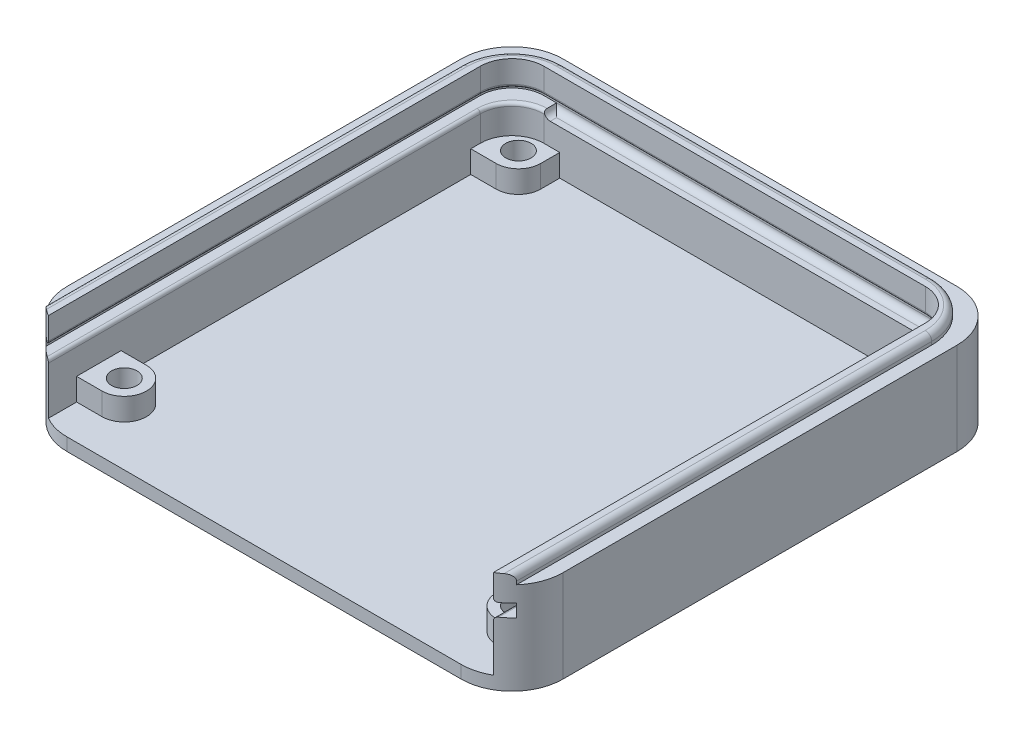
from build123d import *

# Parameters (mm, degrees)
BOSS_EXTRUDE1_DEPTH = 16
SKETCH2_4_W         = 74
SKETCH2_4_H         = 76
BOSS_EXTRUDE2_DEPTH = 2
SKETCH3_W           = 2
SKETCH3_H           = 4
SKETCH3_H_2         = 8
BOSS_EXTRUDE3_DEPTH = 76
LPATTERN1_COUNT     = 2
LPATTERN1_PITCH     = 72
SKETCH4_W           = 2
SKETCH4_H           = 4
SKETCH4_H_2         = 8
BOSS_EXTRUDE5_DEPTH = 71
FILLET2_R           = 5
SKETCH7_R           = 2
BOSS_EXTRUDE9_DEPTH = 3.5
SKETCH8_W           = 60
SKETCH8_H           = 1
CUT_EXTRUDE1_DEPTH  = 2
FILLET12_R          = 1
SKETCH11_W          = 2
SKETCH11_H          = 1.5
CUT_EXTRUDE2_DEPTH  = 112.462998345
SKETCH12_W          = 2
SKETCH12_H          = 1.5
CUT_EXTRUDE3_DEPTH  = 111.072703247
FILLET13_R          = 8
FILLET14_R          = 1
FILLET16_R          = 0.5


# Some blends are built 0.0001 mm under size
with BuildPart() as part:
    # Sketch2 → Boss-Extrude1 (new body)
    with BuildSketch(Plane(origin=(0, 0, 0), x_dir=(1, 0, 0), z_dir=(0, 1, 0))):
        Polygon((-78, 0), (-76, 0), (-76, 76), (-2, 76), (-2, 0), (0, 0), (0, 78), (-78, 78), align=None)
    extrude(amount=BOSS_EXTRUDE1_DEPTH)

    # Sketch2<4> → Boss-Extrude2 (add)
    with BuildSketch(Plane(origin=(0, 0, 0), x_dir=(1, 0, 0), z_dir=(0, 1, 0))):
        with Locations((-39, 38)):
            Rectangle(SKETCH2_4_W, SKETCH2_4_H)
    extrude(amount=BOSS_EXTRUDE2_DEPTH)

    # Sketch3 → Boss-Extrude3 (add)
    with BuildSketch(Plane.XY):
        with Locations((-75, 14)):
            Rectangle(SKETCH3_W, SKETCH3_H)
        with Locations((-75, 6)):
            Rectangle(SKETCH3_W, SKETCH3_H_2)
    boss_extrude3 = extrude(amount=-BOSS_EXTRUDE3_DEPTH)

    # LPattern1: Boss-Extrude3 ×2
    with Locations(*[(i * LPATTERN1_PITCH, 0, 0) for i in range(1, LPATTERN1_COUNT)]):
        add(boss_extrude3)

    # Sketch4 → Boss-Extrude5 (add)
    with BuildSketch(Plane(origin=(-74, 0, 0), x_dir=(0, 0, -1), z_dir=(1, 0, 0))):
        with Locations((75, 14)):
            Rectangle(SKETCH4_W, SKETCH4_H)
        with Locations((75, 6)):
            Rectangle(SKETCH4_W, SKETCH4_H_2)
    extrude(amount=BOSS_EXTRUDE5_DEPTH)

    # Fillet2
    fillet2_edges = [part.edges().sort_by_distance(p)[0] for p in [
        (-74, 14, -74),
        (-4, 6, -74),
        (-74, 6, -74),
        (-76, 11, -76),
        (-2, 11, -76),
        (-4, 14, -74),
    ]]
    fillet(fillet2_edges, radius=FILLET2_R)

    # Sketch7 → Boss-Extrude9 (add)
    # profile 1 of 4: a face of its own
    with BuildSketch(Plane(origin=(0, 2, 0), x_dir=(1, 0, 0), z_dir=(0, 1, 0))):
        with BuildLine():
            Line((-66.5, 74.491060011), (-74, 74.491060011))
            Line((-74, 74.491060011), (-74, 67.5))
            Line((-74, 67.5), (-70, 67.5))
            ThreePointArc((-70, 67.5), (-67.525126266, 68.525126266), (-66.5, 71))
            Line((-66.5, 71), (-66.5, 74.491060011))
        make_face()
        with Locations(Location((-70, 71, 0), (0, 0, 270))):
            Circle(SKETCH7_R, mode=Mode.SUBTRACT)
    # profile 2 of 4: a face of its own
    with BuildSketch(Plane(origin=(0, 2, 0), x_dir=(1, 0, 0), z_dir=(0, 1, 0))):
        with BuildLine():
            ThreePointArc((-11.5, 71), (-10.474873734, 68.525126266), (-8, 67.5))
            Line((-8, 67.5), (-4, 67.5))
            Line((-4, 67.5), (-4, 74.5))
            Line((-4, 74.5), (-11.5, 74.5))
            Line((-11.5, 74.5), (-11.5, 71))
        make_face()
        with Locations(Location((-8, 71, 0), (0, 0, 270))):
            Circle(SKETCH7_R, mode=Mode.SUBTRACT)
    # profile 3 of 4: a face of its own
    with BuildSketch(Plane(origin=(0, 2, 0), x_dir=(1, 0, 0), z_dir=(0, 1, 0))):
        with BuildLine():
            Line((-74, 5.5), (-70, 5.5))
            ThreePointArc((-70, 5.5), (-66.5, 9), (-70, 12.5))
            Line((-70, 12.5), (-74, 12.5))
            Line((-74, 12.5), (-74, 5.5))
        make_face()
        with Locations(Location((-70, 9, 0), (0, 0, 270))):
            Circle(SKETCH7_R, mode=Mode.SUBTRACT)
    # profile 4 of 4: a face of its own
    with BuildSketch(Plane(origin=(0, 2, 0), x_dir=(1, 0, 0), z_dir=(0, 1, 0))):
        with BuildLine():
            Line((-4, 12.5), (-8, 12.5))
            ThreePointArc((-8, 12.5), (-11.5, 9), (-8, 5.5))
            Line((-8, 5.5), (-4, 5.5))
            Line((-4, 5.5), (-4, 12.5))
        make_face()
        with Locations(Location((-8, 9, 0), (0, 0, 270))):
            Circle(SKETCH7_R, mode=Mode.SUBTRACT)
    extrude(amount=BOSS_EXTRUDE9_DEPTH)

    # Sketch8 → Cut-Extrude1 (cut)
    with BuildSketch(Plane.XY.offset(-74)):
        with Locations((-39, 9.5)):
            Rectangle(SKETCH8_W, SKETCH8_H)
    extrude(amount=-CUT_EXTRUDE1_DEPTH, mode=Mode.SUBTRACT)

    # Fillet12
    fillet12_edges = [part.edges().sort_by_distance(p)[0] for p in [
        (-9, 9, -75),
        (-69, 9, -75),
        (-39, 9, -76),
    ]]
    fillet(fillet12_edges, radius=FILLET12_R - 0.0001)  # a hair under: the kernel refuses the full size

    # Sketch11 → Cut-Extrude2 (cut, through all)
    with BuildSketch(Plane.XY):
        with Locations((-77, 15.25)):
            Rectangle(SKETCH11_W, SKETCH11_H)
        with Locations((-1, 15.25)):
            Rectangle(SKETCH11_W, SKETCH11_H)
    extrude(amount=-CUT_EXTRUDE2_DEPTH, mode=Mode.SUBTRACT)

    # Sketch12 → Cut-Extrude3 (cut, through all)
    with BuildSketch(Plane.ZY.offset(76)):
        with Locations((-77, 15.25)):
            Rectangle(SKETCH12_W, SKETCH12_H)
    extrude(amount=-CUT_EXTRUDE3_DEPTH, mode=Mode.SUBTRACT)

    # Fillet13
    # the kernel refuses this fillet: 8 mm, written as the material it takes off along each edge
    with BuildSketch(Plane(origin=(-78, -20, -78), x_dir=(0, 0, 1), z_dir=(0, 1, 0)), Plane(origin=(0, -20, -78), x_dir=(-1, 0, 0), z_dir=(0, 1, 0)), Plane(origin=(-78, -20, 0), x_dir=(1, 0, 0), z_dir=(0, 1, 0))) as fillet13_piece_1:
        with BuildLine():
            CenterArc((FILLET13_R, FILLET13_R), FILLET13_R, 180, 90)
            Line((0, FILLET13_R), (0, 0))
            Line((0, 0), (FILLET13_R, 0))
        make_face()
    extrude(amount=54.5, mode=Mode.SUBTRACT)
    with BuildSketch(Plane(origin=(-76, 36, -76), x_dir=(0, 0, 1), z_dir=(0, -1, 0)), Plane(origin=(-2, 36, -76), x_dir=(-1, 0, 0), z_dir=(0, -1, 0))) as fillet13_piece_2:
        with BuildLine():
            CenterArc((FILLET13_R, -FILLET13_R), FILLET13_R, 90, 90)
            Line((0, -FILLET13_R), (0, 0))
            Line((0, 0), (FILLET13_R, 0))
        make_face()
    extrude(amount=21.5, mode=Mode.SUBTRACT)
    with BuildSketch(Plane(origin=(0, -20, 0), x_dir=(-1, 0, 0), z_dir=(0, 1, 0))) as fillet13_piece_3:
        with BuildLine():
            CenterArc((FILLET13_R, -FILLET13_R), FILLET13_R, 90, 90)
            Line((0, -FILLET13_R), (0, 0))
            Line((0, 0), (FILLET13_R, 0))
        make_face()
    extrude(amount=54.5, mode=Mode.SUBTRACT)

    # Fillet14
    fillet14_edges = [part.edges().sort_by_distance(p)[0] for p in [
        (-39, 16, -76),
        (-76, 16, -35.354248689),
        (-2, 16, -35.354248689),
        (-4.343145751, 16, -73.656854249),
        (-73.656854249, 16, -73.656854249),
    ]]
    fillet(fillet14_edges, radius=FILLET14_R)

    # Fillet16
    # the kernel refuses this fillet: 0.5 mm, written as the material it takes off along each edge
    with BuildSketch(Plane(origin=(-74, 10, 0.17820323), x_dir=(0, -1, 0), z_dir=(0, 0, -1)), Plane(origin=(-4, 10, 0.17820323), x_dir=(1, 0, 0), z_dir=(0, 0, -1)), Plane(origin=(-4, 12, 0.17820323), x_dir=(0, 1, 0), z_dir=(0, 0, -1)), Plane(origin=(-74, 12, 0.17820323), x_dir=(-1, 0, 0), z_dir=(0, 0, -1))) as fillet16_piece_1:
        with BuildLine():
            CenterArc((FILLET16_R, FILLET16_R), FILLET16_R, 180, 90)
            Line((0, FILLET16_R), (0, 0))
            Line((0, 0), (FILLET16_R, 0))
        make_face()
    extrude(amount=69.17820323, mode=Mode.SUBTRACT)
    with BuildSketch(Plane(origin=(-69, 12, -74), x_dir=(0, 0, -1), z_dir=(1, 0, 0))) as fillet16_piece_2:
        with BuildLine():
            CenterArc((FILLET16_R, FILLET16_R), FILLET16_R, 180, 90)
            Line((0, FILLET16_R), (0, 0))
            Line((0, 0), (FILLET16_R, 0))
        make_face()
    extrude(amount=60, mode=Mode.SUBTRACT)
    with BuildSketch(Plane(origin=(-9, 12, -69), x_dir=(1, 0, 0), z_dir=(0, 0, 1))) as fillet16_piece_3:
        with BuildLine():
            CenterArc((5 + FILLET16_R, FILLET16_R), FILLET16_R, 180, 90)
            Line((5, FILLET16_R), (5, 0))
            Line((5, 0), (5 + FILLET16_R, 0))
        make_face()
    revolve(axis=Axis((-9, 12, -69), (0, 1, 0)), revolution_arc=90, mode=Mode.SUBTRACT)
    with BuildSketch(Plane(origin=(-9, 10, -69), x_dir=(1, 0, 0), z_dir=(0, 0, 1))) as fillet16_piece_4:
        with BuildLine():
            CenterArc((5 + FILLET16_R, -FILLET16_R), FILLET16_R, 90, 90)
            Line((5, -FILLET16_R), (5, 0))
            Line((5, 0), (5 + FILLET16_R, 0))
        make_face()
    revolve(axis=Axis((-9, 10, -69), (0, 1, 0)), revolution_arc=104.329698924, mode=Mode.SUBTRACT)
    with BuildSketch(Plane(origin=(-69, 12, -69), x_dir=(0, 0, -1), z_dir=(1, 0, 0))) as fillet16_piece_5:
        with BuildLine():
            CenterArc((5 + FILLET16_R, FILLET16_R), FILLET16_R, 180, 90)
            Line((5, FILLET16_R), (5, 0))
            Line((5, 0), (5 + FILLET16_R, 0))
        make_face()
    revolve(axis=Axis((-69, 12, -69), (0, 1, 0)), revolution_arc=90, mode=Mode.SUBTRACT)
    with BuildSketch(Plane(origin=(-69, 10, -69), x_dir=(0.24750126301206582, 0, -0.9688875707776585), z_dir=(0.9688875707776585, 0, 0.24750126301206582))) as fillet16_piece_6:
        with BuildLine():
            CenterArc((5 + FILLET16_R, -FILLET16_R), FILLET16_R, 90, 90)
            Line((5, -FILLET16_R), (5, 0))
            Line((5, 0), (5 + FILLET16_R, 0))
        make_face()
    revolve(axis=Axis((-69, 10, -69), (0, 1, 0)), revolution_arc=104.329698924, mode=Mode.SUBTRACT)


solid = part.part
